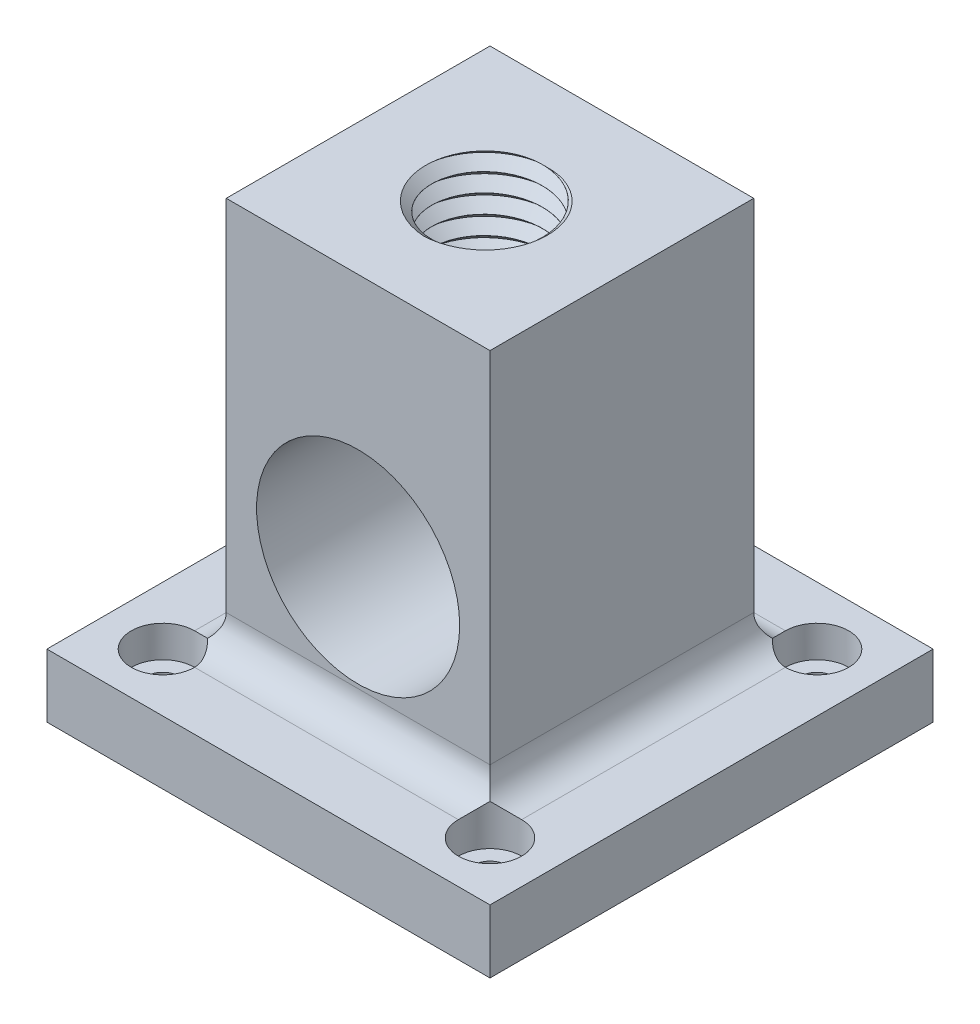
from build123d import *

# Parameters (mm, degrees)
SKETCH_1_W          = 42
SKETCH_1_H          = 42
SKETCH_1_R          = 3
SKETCH_1_R_2        = 1.55
EXTRUDE_1_DEPTH     = 3
SKETCH_1_4_W        = 42
SKETCH_1_4_H        = 42
SKETCH_1_4_R        = 3
EXTRUDE_2_DEPTH     = 3
SKETCH_2_W          = 25
SKETCH_2_H          = 25
EXTRUDE_3_DEPTH     = 37
CUT_EXTRUDE_1_REACH = 58.243
SKETCH_3_R          = 9.625
SKETCH_4_2_R        = 5.25
CUT_EXTRUDE_2_DEPTH = 12
SWEEP_1_PITCH       = 1.75
FILLET_1_R          = 3


with BuildPart() as part:
    # 草图1 → 凸台-拉伸1 (new body)
    # profile 1 of 5: a face of its own
    with BuildSketch(Plane(origin=(0, 0, 0), x_dir=(1, 0, 0), z_dir=(0, 1, 0))):
        Rectangle(SKETCH_1_W, SKETCH_1_H)
        with Locations((-15.5, -15.5)):
            Circle(SKETCH_1_R, mode=Mode.SUBTRACT)
        with Locations((15.5, -15.5)):
            Circle(SKETCH_1_R, mode=Mode.SUBTRACT)
        with Locations((15.5, 15.5)):
            Circle(SKETCH_1_R, mode=Mode.SUBTRACT)
        with Locations((-15.5, 15.5)):
            Circle(SKETCH_1_R, mode=Mode.SUBTRACT)
    # profile 2 of 5: a face of its own
    with BuildSketch(Plane(origin=(0, 0, 0), x_dir=(1, 0, 0), z_dir=(0, 1, 0))):
        with Locations((15.5, -15.5)):
            Circle(SKETCH_1_R)
        with Locations(Location((15.5, -15.5, 0), (0, 0, 270))):
            Circle(SKETCH_1_R_2, mode=Mode.SUBTRACT)
    # profile 3 of 5: a face of its own
    with BuildSketch(Plane(origin=(0, 0, 0), x_dir=(1, 0, 0), z_dir=(0, 1, 0))):
        with Locations((15.5, 15.5)):
            Circle(SKETCH_1_R)
        with Locations(Location((15.5, 15.5, 0), (0, 0, 270))):
            Circle(SKETCH_1_R_2, mode=Mode.SUBTRACT)
    # profile 4 of 5: a face of its own
    with BuildSketch(Plane(origin=(0, 0, 0), x_dir=(1, 0, 0), z_dir=(0, 1, 0))):
        with Locations((-15.5, 15.5)):
            Circle(SKETCH_1_R)
        with Locations(Location((-15.5, 15.5, 0), (0, 0, 270))):
            Circle(SKETCH_1_R_2, mode=Mode.SUBTRACT)
    # profile 5 of 5: a face of its own
    with BuildSketch(Plane(origin=(0, 0, 0), x_dir=(1, 0, 0), z_dir=(0, 1, 0))):
        with Locations((-15.5, -15.5)):
            Circle(SKETCH_1_R)
        with Locations(Location((-15.5, -15.5, 0), (0, 0, 270))):
            Circle(SKETCH_1_R_2, mode=Mode.SUBTRACT)
    extrude(amount=-EXTRUDE_1_DEPTH)

    # 草图1<4> → 凸台-拉伸2 (add)
    with BuildSketch(Plane(origin=(0, 0, 0), x_dir=(1, 0, 0), z_dir=(0, 1, 0))):
        Rectangle(SKETCH_1_4_W, SKETCH_1_4_H)
        with Locations(Location((-15.5, -15.5, 0), (0, 0, 270))):
            Circle(SKETCH_1_4_R, mode=Mode.SUBTRACT)
        with Locations(Location((15.5, -15.5, 0), (0, 0, 270))):
            Circle(SKETCH_1_4_R, mode=Mode.SUBTRACT)
        with Locations(Location((15.5, 15.5, 0), (0, 0, 270))):
            Circle(SKETCH_1_4_R, mode=Mode.SUBTRACT)
        with Locations(Location((-15.5, 15.5, 0), (0, 0, 270))):
            Circle(SKETCH_1_4_R, mode=Mode.SUBTRACT)
    extrude(amount=EXTRUDE_2_DEPTH)

    # 草图2 → 凸台-拉伸3 (add)
    with BuildSketch(Plane(origin=(0, 3, 0), x_dir=(1, 0, 0), z_dir=(0, 1, 0))):
        Rectangle(SKETCH_2_W, SKETCH_2_H)
    extrude(amount=EXTRUDE_3_DEPTH)

    # 草图3 → 切除-拉伸1 (cut, up to next)
    with BuildSketch(Plane.XY.offset(12.5), mode=Mode.PRIVATE) as cut_extrude_1_sk1:
        with Locations((0, 16)):
            Circle(SKETCH_3_R)
    cut_extrude_1_tool1 = extrude(cut_extrude_1_sk1.sketch, amount=-CUT_EXTRUDE_1_REACH, mode=Mode.PRIVATE) & part.part
    add(cut_extrude_1_tool1.solids().sort_by_distance((0, 16, 12.5))[0], mode=Mode.SUBTRACT)

    # 草图4<2> → 切除-拉伸2 (cut)
    with BuildSketch(Plane(origin=(0, 40, 0), x_dir=(1, 0, 0), z_dir=(0, 1, 0))):
        with Locations(Location((0, 0, 0), (0, 0, 270))):
            Circle(SKETCH_4_2_R)
    extrude(amount=-CUT_EXTRUDE_2_DEPTH, mode=Mode.SUBTRACT)

    # 切除-扫描1: arcs per turn and ends read off the stored shape
    # 切除-扫描1: the profile of 草图5 screwed along a right-hand helix through 8.5 turns, 10 arcs to a turn; built about Z, then put on its axis
    sweep_1_z = Axis((0, 0, 0), (0, 0, 1))
    sweep_1_corners = [(5.25, 0, -1.75), (5.25, 0, -0.88), (6.25, 0, -1.75), (5.25, 0, -2.62)]
    with BuildLine(mode=Mode.PRIVATE) as sweep_1_profile:
        Line(sweep_1_corners[0], sweep_1_corners[1])
        Line(sweep_1_corners[1], sweep_1_corners[2])
        Line(sweep_1_corners[2], sweep_1_corners[3])
        Line(sweep_1_corners[3], sweep_1_corners[0])
    sweep_1_cap = Face(sweep_1_profile.wire())
    sweep_1_turn_angles = [0, 18, 36, 54, 72, 90, 108, 126, 144, 162, 180, 198, 216, 234, 252, 270, 288, 306, 324, 342, 360]
    sweep_1_turn_weights = [1, 0.9510565162951535, 1, 0.9510565162951535, 1, 0.9510565162951535, 1, 0.9510565162951535, 1, 0.9510565162951535, 1, 0.9510565162951535, 1, 0.9510565162951535, 1, 0.9510565162951535, 1, 0.9510565162951535, 1, 0.9510565162951535, 1]
    sweep_1_turn_rails = [Edge.make_bspline([Vector(p[0], p[1], 0).rotate(sweep_1_z, sweep_1_turn_angles[k]) / sweep_1_turn_weights[k] + Vector(0, 0, p[2] + SWEEP_1_PITCH * sweep_1_turn_angles[k] / 360) for k in range(21)], [0, 0, 0, 1, 1, 2, 2, 3, 3, 4, 4, 5, 5, 6, 6, 7, 7, 8, 8, 9, 9, 10, 10, 10], 2, sweep_1_turn_weights) for p in sweep_1_corners]
    sweep_1_turn_sides = [Face.make_surface_from_curves(sweep_1_turn_rails[p[0]], sweep_1_turn_rails[p[1]]) for p in [(0, 1), (1, 2), (2, 3), (3, 0)]]
    sweep_1_last_angles = [2880, 2898, 2916, 2934, 2952, 2970, 2988, 3006, 3024, 3042, 3060]
    sweep_1_last_weights = [1, 0.9510565162951535, 1, 0.9510565162951535, 1, 0.9510565162951535, 1, 0.9510565162951535, 1, 0.9510565162951535, 1]
    sweep_1_last_rails = [Edge.make_bspline([Vector(p[0], p[1], 0).rotate(sweep_1_z, sweep_1_last_angles[k]) / sweep_1_last_weights[k] + Vector(0, 0, p[2] + SWEEP_1_PITCH * sweep_1_last_angles[k] / 360) for k in range(11)], [0, 0, 0, 1, 1, 2, 2, 3, 3, 4, 4, 5, 5, 5], 2, sweep_1_last_weights) for p in sweep_1_corners]
    sweep_1_last_sides = [Face.make_surface_from_curves(sweep_1_last_rails[p[0]], sweep_1_last_rails[p[1]]) for p in [(0, 1), (1, 2), (2, 3), (3, 0)]]
    sweep_1 = Plane(origin=(0, 40, 0), x_dir=(0, 0, 1), z_dir=(0, -1, 0)) * Solid(Shell([*[p.moved(Location((0, 0, SWEEP_1_PITCH * i))) for i in range(8) for p in sweep_1_turn_sides], *sweep_1_last_sides, sweep_1_cap, sweep_1_cap.rotate(sweep_1_z, 3060).moved(Location((0, 0, SWEEP_1_PITCH * 3060 / 360)))]))
    add(sweep_1, mode=Mode.SUBTRACT)

    # 圆角1
    # the kernel refuses this fillet: 3 mm, written as the material it adds along each edge
    with BuildSketch(Plane(origin=(12.5, 3, -12.5), x_dir=(1, 0, 0), z_dir=(0, 0, 1)), Plane(origin=(-12.5, 3, -12.5), x_dir=(0, 0, -1), z_dir=(1, 0, 0)), Plane(origin=(-12.5, 3, 12.5), x_dir=(-1, 0, 0), z_dir=(0, 0, -1)), Plane(origin=(12.5, 3, 12.5), x_dir=(0, 0, 1), z_dir=(-1, 0, 0))) as fillet_1_piece_1:
        with BuildLine():
            CenterArc((FILLET_1_R, FILLET_1_R), FILLET_1_R, 180, 90)
            Line((0, FILLET_1_R), (0, 0))
            Line((0, 0), (FILLET_1_R, 0))
        make_face()
    extrude(amount=25)
    with BuildSketch(Plane(origin=(-12.5, 3, -12.5), x_dir=(0, 0, -1), z_dir=(1, 0, 0))) as fillet_1_piece_2a_section:
        with BuildLine():
            CenterArc((FILLET_1_R, FILLET_1_R), FILLET_1_R, 180, 90)
            Line((0, FILLET_1_R), (0, 0))
            Line((0, 0), (FILLET_1_R, 0))
        make_face()
    fillet_1_piece_2a = extrude(amount=32.5, mode=Mode.PRIVATE)
    fillet_1_piece_2a = fillet_1_piece_2a - Plane(origin=(15.5, 3, -15.5), x_dir=(0, 0, 1), z_dir=(0, -1, 0)) * Cylinder(3, 77, mode=Mode.PRIVATE)
    fillet_1_piece_2a = split(fillet_1_piece_2a, bisect_by=Plane(origin=(12.5, 3, -12.5), z_dir=(1, 0, 0)), keep=Keep.TOP, mode=Mode.PRIVATE)
    with BuildSketch(Plane(origin=(12.5, 3, -20), x_dir=(1, 0, 0), z_dir=(0, 0, 1))) as fillet_1_piece_2b_section:
        with BuildLine():
            CenterArc((FILLET_1_R, FILLET_1_R), FILLET_1_R, 180, 90)
            Line((0, FILLET_1_R), (0, 0))
            Line((0, 0), (FILLET_1_R, 0))
        make_face()
    fillet_1_piece_2b = extrude(amount=32.5, mode=Mode.PRIVATE)
    fillet_1_piece_2b = fillet_1_piece_2b - Plane(origin=(15.5, 3, -15.5), x_dir=(0, 0, 1), z_dir=(0, -1, 0)) * Cylinder(3, 77, mode=Mode.PRIVATE)
    fillet_1_piece_2b = split(fillet_1_piece_2b, bisect_by=Plane(origin=(12.5, 3, -12.5), z_dir=(0, 0, -1)), keep=Keep.TOP, mode=Mode.PRIVATE)
    fillet_1_piece_2 = fillet_1_piece_2a & fillet_1_piece_2b
    add(fillet_1_piece_2)
    with BuildSketch(Plane(origin=(12.5, 3, -12.5), x_dir=(1, 0, 0), z_dir=(0, 0, 1))) as fillet_1_piece_3a_section:
        with BuildLine():
            CenterArc((FILLET_1_R, FILLET_1_R), FILLET_1_R, 180, 90)
            Line((0, FILLET_1_R), (0, 0))
            Line((0, 0), (FILLET_1_R, 0))
        make_face()
    fillet_1_piece_3a = extrude(amount=32.5, mode=Mode.PRIVATE)
    fillet_1_piece_3a = fillet_1_piece_3a - Plane(origin=(15.5, 3, 15.5), x_dir=(0, 0, 1), z_dir=(0, -1, 0)) * Cylinder(3, 77, mode=Mode.PRIVATE)
    fillet_1_piece_3a = split(fillet_1_piece_3a, bisect_by=Plane(origin=(12.5, 3, 12.5), z_dir=(0, 0, 1)), keep=Keep.TOP, mode=Mode.PRIVATE)
    with BuildSketch(Plane(origin=(20, 3, 12.5), x_dir=(0, 0, 1), z_dir=(-1, 0, 0))) as fillet_1_piece_3b_section:
        with BuildLine():
            CenterArc((FILLET_1_R, FILLET_1_R), FILLET_1_R, 180, 90)
            Line((0, FILLET_1_R), (0, 0))
            Line((0, 0), (FILLET_1_R, 0))
        make_face()
    fillet_1_piece_3b = extrude(amount=32.5, mode=Mode.PRIVATE)
    fillet_1_piece_3b = fillet_1_piece_3b - Plane(origin=(15.5, 3, 15.5), x_dir=(0, 0, 1), z_dir=(0, -1, 0)) * Cylinder(3, 77, mode=Mode.PRIVATE)
    fillet_1_piece_3b = split(fillet_1_piece_3b, bisect_by=Plane(origin=(12.5, 3, 12.5), z_dir=(1, 0, 0)), keep=Keep.TOP, mode=Mode.PRIVATE)
    fillet_1_piece_3 = fillet_1_piece_3a & fillet_1_piece_3b
    add(fillet_1_piece_3)
    with BuildSketch(Plane(origin=(-20, 3, -12.5), x_dir=(0, 0, -1), z_dir=(1, 0, 0))) as fillet_1_piece_4a_section:
        with BuildLine():
            CenterArc((FILLET_1_R, FILLET_1_R), FILLET_1_R, 180, 90)
            Line((0, FILLET_1_R), (0, 0))
            Line((0, 0), (FILLET_1_R, 0))
        make_face()
    fillet_1_piece_4a = extrude(amount=32.5, mode=Mode.PRIVATE)
    fillet_1_piece_4a = fillet_1_piece_4a - Plane(origin=(-15.5, 3, -15.5), x_dir=(0, 0, 1), z_dir=(0, -1, 0)) * Cylinder(3, 77, mode=Mode.PRIVATE)
    fillet_1_piece_4a = split(fillet_1_piece_4a, bisect_by=Plane(origin=(-12.5, 3, -12.5), z_dir=(-1, 0, 0)), keep=Keep.TOP, mode=Mode.PRIVATE)
    with BuildSketch(Plane(origin=(-12.5, 3, 12.5), x_dir=(-1, 0, 0), z_dir=(0, 0, -1))) as fillet_1_piece_4b_section:
        with BuildLine():
            CenterArc((FILLET_1_R, FILLET_1_R), FILLET_1_R, 180, 90)
            Line((0, FILLET_1_R), (0, 0))
            Line((0, 0), (FILLET_1_R, 0))
        make_face()
    fillet_1_piece_4b = extrude(amount=32.5, mode=Mode.PRIVATE)
    fillet_1_piece_4b = fillet_1_piece_4b - Plane(origin=(-15.5, 3, -15.5), x_dir=(0, 0, 1), z_dir=(0, -1, 0)) * Cylinder(3, 77, mode=Mode.PRIVATE)
    fillet_1_piece_4b = split(fillet_1_piece_4b, bisect_by=Plane(origin=(-12.5, 3, -12.5), z_dir=(0, 0, -1)), keep=Keep.TOP, mode=Mode.PRIVATE)
    fillet_1_piece_4 = fillet_1_piece_4a & fillet_1_piece_4b
    add(fillet_1_piece_4)
    with BuildSketch(Plane(origin=(12.5, 3, 12.5), x_dir=(0, 0, 1), z_dir=(-1, 0, 0))) as fillet_1_piece_5a_section:
        with BuildLine():
            CenterArc((FILLET_1_R, FILLET_1_R), FILLET_1_R, 180, 90)
            Line((0, FILLET_1_R), (0, 0))
            Line((0, 0), (FILLET_1_R, 0))
        make_face()
    fillet_1_piece_5a = extrude(amount=32.5, mode=Mode.PRIVATE)
    fillet_1_piece_5a = fillet_1_piece_5a - Plane(origin=(-15.5, 3, 15.5), x_dir=(0, 0, 1), z_dir=(0, -1, 0)) * Cylinder(3, 77, mode=Mode.PRIVATE)
    fillet_1_piece_5a = split(fillet_1_piece_5a, bisect_by=Plane(origin=(-12.5, 3, 12.5), z_dir=(-1, 0, 0)), keep=Keep.TOP, mode=Mode.PRIVATE)
    with BuildSketch(Plane(origin=(-12.5, 3, 20), x_dir=(-1, 0, 0), z_dir=(0, 0, -1))) as fillet_1_piece_5b_section:
        with BuildLine():
            CenterArc((FILLET_1_R, FILLET_1_R), FILLET_1_R, 180, 90)
            Line((0, FILLET_1_R), (0, 0))
            Line((0, 0), (FILLET_1_R, 0))
        make_face()
    fillet_1_piece_5b = extrude(amount=32.5, mode=Mode.PRIVATE)
    fillet_1_piece_5b = fillet_1_piece_5b - Plane(origin=(-15.5, 3, 15.5), x_dir=(0, 0, 1), z_dir=(0, -1, 0)) * Cylinder(3, 77, mode=Mode.PRIVATE)
    fillet_1_piece_5b = split(fillet_1_piece_5b, bisect_by=Plane(origin=(-12.5, 3, 12.5), z_dir=(0, 0, 1)), keep=Keep.TOP, mode=Mode.PRIVATE)
    fillet_1_piece_5 = fillet_1_piece_5a & fillet_1_piece_5b
    add(fillet_1_piece_5)


solid = part.part
